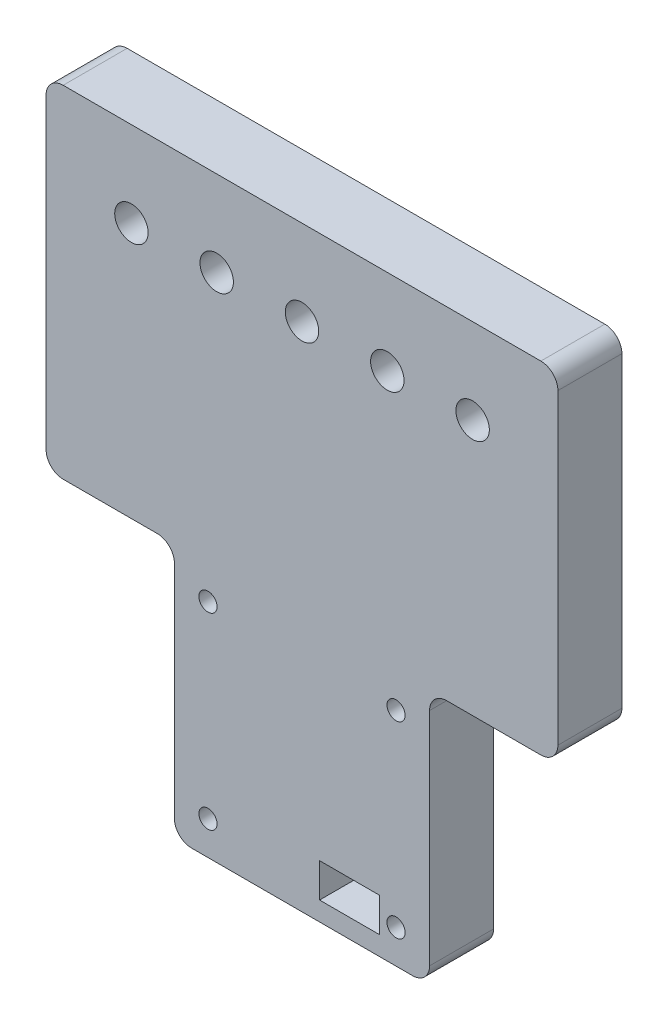
from build123d import *

# Parameters (mm, degrees)
SKETCH1_W                    = 38
SKETCH1_H                    = 38
BOSS_EXTRUDE1_DEPTH          = 9.525
F_36_0_1065_DIAMETER_HOLE2_D = 2.7051
SKETCH7_W                    = 8.89
SKETCH7_H                    = 5.08
CUT_EXTRUDE1_DEPTH           = 29.508343077
SKETCH8_W                    = 76.2
SKETCH8_H                    = 9.525
BOSS_EXTRUDE2_DEPTH          = 50.8
F_9_0_196_DIAMETER_HOLE1_D   = 4.9784
FILLET1_R                    = 2.54


with BuildPart() as part:
    # Sketch1 → Boss-Extrude1 (new body)
    with BuildSketch(Plane(origin=(0, 0, 0), x_dir=(0, 1, 0), z_dir=(0, 0, 1))):
        Rectangle(SKETCH1_W, SKETCH1_H)
    extrude(amount=BOSS_EXTRUDE1_DEPTH)

    # #36 (0.1065) Diameter Hole2 (through all)
    with Locations(Plane.XY.offset(9.525)):
        with Locations((-14, -14), (14, -14), (14, 14), (-14, 14)):
            Hole(F_36_0_1065_DIAMETER_HOLE2_D / 2)

    # Sketch7 → Cut-Extrude1 (cut, through all)
    with BuildSketch(Plane(origin=(0, 0, 0), x_dir=(1, 0, 0), z_dir=(0, 0, -1))):
        with Locations((7.05999991, 13.629999978)):
            Rectangle(SKETCH7_W, SKETCH7_H)
    extrude(amount=-CUT_EXTRUDE1_DEPTH, mode=Mode.SUBTRACT)

    # Sketch8 → Boss-Extrude2 (add)
    with BuildSketch(Plane(origin=(0, 19, 0), x_dir=(-1, 0, 0), z_dir=(0, 1, 0))):
        with Locations((0, 4.7625)):
            Rectangle(SKETCH8_W, SKETCH8_H)
    extrude(amount=BOSS_EXTRUDE2_DEPTH)

    # #9 (0.196) Diameter Hole1 (through all)
    with Locations(Plane(origin=(0, 0, 0), x_dir=(1, 0, 0), z_dir=(0, 0, -1))):
        with Locations((-25.4, -57.1), (-12.7, -57.1), (0, -57.1), (12.7, -57.1), (25.4, -57.1)):
            Hole(F_9_0_196_DIAMETER_HOLE1_D / 2)

    # Fillet1
    fillet1_edges = [part.edges().sort_by_distance(p)[0] for p in [
        (-38.1, 69.8, 4.7625),
        (38.1, 69.8, 4.7625),
        (38.1, 19, 4.7625),
        (19, 19, 4.7625),
        (19, -19, 4.7625),
        (-19, -19, 4.7625),
        (-19, 19, 4.7625),
        (-38.1, 19, 4.7625),
    ]]
    fillet(fillet1_edges, radius=FILLET1_R)


solid = part.part
